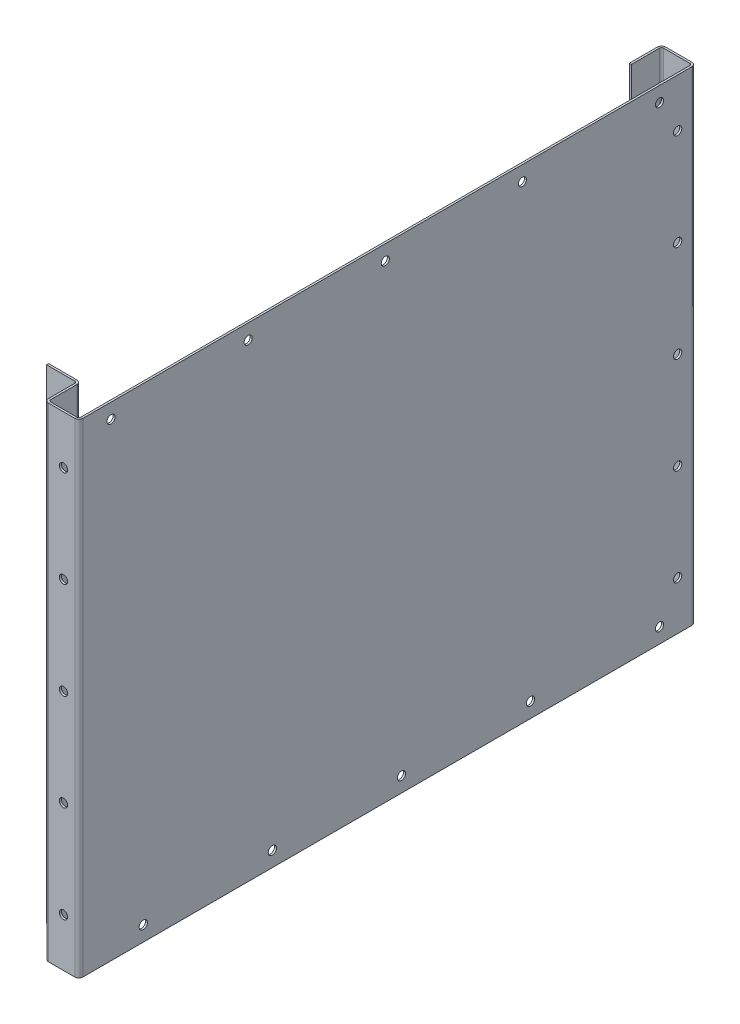
from build123d import *

# Parameters (mm, degrees)
SKETCH1_W                    = 482.6
SKETCH1_H                    = 381
BOSS_EXTRUDE1_DEPTH          = 0.9144
CONVERT_SOLID1_START         = -241.3
CONVERT_SOLID1_OUTLINE_W     = 0.6858
CONVERT_SOLID1_OUTLINE_H     = 381
CONVERT_SOLID1_DEPTH         = 482.6
EDGE_FLANGE1_STRIP_W         = 9.6012
EDGE_FLANGE1_STRIP_H         = 1.6002
EDGE_FLANGE1_STRIP_CUT_DEPTH = 381
EDGE_FLANGE1_DEPTH           = 381
EDGE_FLANGE2_STRIP_W         = 9.6012
EDGE_FLANGE2_STRIP_H         = 1.6002
EDGE_FLANGE2_STRIP_CUT_DEPTH = 381
EDGE_FLANGE2_DEPTH           = 381
EDGE_FLANGE3_STRIP_W         = 9.6012
EDGE_FLANGE3_STRIP_H         = 1.6002
EDGE_FLANGE3_STRIP_CUT_DEPTH = 381
EDGE_FLANGE3_DEPTH           = 381
EDGE_FLANGE4_STRIP_W         = 9.6012
EDGE_FLANGE4_STRIP_H         = 1.6002
EDGE_FLANGE4_STRIP_CUT_DEPTH = 381
EDGE_FLANGE4_DEPTH           = 381
EDGE_FLANGE5_STRIP_W         = 9.6012
EDGE_FLANGE5_STRIP_H         = 1.6002
EDGE_FLANGE5_STRIP_CUT_DEPTH = 381
EDGE_FLANGE5_DEPTH           = 381
SKETCH26_R                   = 3.2639
CUT_EXTRUDE2_DEPTH           = 2.54
SKETCH29_R                   = 3.2639
CUT_EXTRUDE4_DEPTH           = 310.870566463
SKETCH30_R                   = 3.2639
CUT_EXTRUDE5_DEPTH           = 2.54
SKETCH31_R                   = 3.19661248
CUT_EXTRUDE6_DEPTH           = 2.54
SKETCH32_R                   = 3.2639
CUT_EXTRUDE7_DEPTH           = 2.54


# Read off the part's stored shape, not the designer's step: Convert-Solid1
# Sheet-metal steps are written as plain solids
with BuildPart() as part:
    # Sketch1 → Boss-Extrude1 (new body)
    with BuildSketch(Plane(origin=(0, 0, 0), x_dir=(0, 0, -1), z_dir=(1, 0, 0))):
        Rectangle(SKETCH1_W, SKETCH1_H)
    extrude(amount=BOSS_EXTRUDE1_DEPTH)

    # Convert-Solid1 outline → Convert-Solid1 (add)
    with BuildSketch(Plane.XY.offset(CONVERT_SOLID1_START)):
        with Locations((-0.3429, 0)):
            Rectangle(CONVERT_SOLID1_OUTLINE_W, CONVERT_SOLID1_OUTLINE_H)
    extrude(amount=CONVERT_SOLID1_DEPTH)

    # Edge-Flange1 strip (across the edge) → Edge-Flange1 strip cut (cut)
    with BuildSketch(Plane(origin=(-0.6858, 190.5, -241.3), x_dir=(0, 0, 1), z_dir=(0, -1, 0))):
        with Locations((-3.2004, -0.8001)):
            Rectangle(EDGE_FLANGE1_STRIP_W, EDGE_FLANGE1_STRIP_H)
    extrude(amount=EDGE_FLANGE1_STRIP_CUT_DEPTH, mode=Mode.SUBTRACT)

    # Edge-Flange1 section (across the edge) → Edge-Flange1 (add)
    with BuildSketch(Plane(origin=(-0.6858, 190.5, -241.3), x_dir=(0, 0, 1), z_dir=(0, -1, 0))):
        with BuildLine():
            Line((-1.6002, 1.6002), (-1.6002, 23.7998))
            Line((-1.6002, 23.7998), (0, 23.7998))
            Line((0, 23.7998), (0, 1.6002))
            ThreePointArc((0, 1.6002), (0.468687729, 0.468687729), (1.6002, 0))
            Line((1.6002, 0), (1.6002, -1.6002))
            ThreePointArc((1.6002, -1.6002), (-0.662824543, -0.662824543), (-1.6002, 1.6002))
        make_face()
    extrude(amount=EDGE_FLANGE1_DEPTH)

    # Edge-Flange2 strip (across the edge) → Edge-Flange2 strip cut (cut)
    with BuildSketch(Plane(origin=(-24.4856, 190.5, -241.3), x_dir=(1, 0, 0), z_dir=(0, -1, 0))):
        with Locations((-3.2004, -0.8001)):
            Rectangle(EDGE_FLANGE2_STRIP_W, EDGE_FLANGE2_STRIP_H)
    extrude(amount=EDGE_FLANGE2_STRIP_CUT_DEPTH, mode=Mode.SUBTRACT)

    # Edge-Flange2 section (across the edge) → Edge-Flange2 (add)
    with BuildSketch(Plane(origin=(-24.4856, 190.5, -241.3), x_dir=(1, 0, 0), z_dir=(0, -1, 0))):
        with BuildLine():
            Line((-1.6002, 1.6002), (-1.6002, 23.7998))
            Line((-1.6002, 23.7998), (0, 23.7998))
            Line((0, 23.7998), (0, 1.6002))
            ThreePointArc((0, 1.6002), (0.468687729, 0.468687729), (1.6002, 0))
            Line((1.6002, 0), (1.6002, -1.6002))
            ThreePointArc((1.6002, -1.6002), (-0.662824543, -0.662824543), (-1.6002, 1.6002))
        make_face()
    extrude(amount=EDGE_FLANGE2_DEPTH)

    # Edge-Flange3 strip (across the edge) → Edge-Flange3 strip cut (cut)
    with BuildSketch(Plane(origin=(-0.6858, -190.5, 241.3), x_dir=(0, 0, -1), z_dir=(0, 1, 0))):
        with Locations((-3.2004, -0.8001)):
            Rectangle(EDGE_FLANGE3_STRIP_W, EDGE_FLANGE3_STRIP_H)
    extrude(amount=EDGE_FLANGE3_STRIP_CUT_DEPTH, mode=Mode.SUBTRACT)

    # Edge-Flange3 section (across the edge) → Edge-Flange3 (add)
    with BuildSketch(Plane(origin=(-0.6858, -190.5, 241.3), x_dir=(0, 0, -1), z_dir=(0, 1, 0))):
        with BuildLine():
            Line((-1.6002, 1.6002), (-1.6002, 23.7998))
            Line((-1.6002, 23.7998), (0, 23.7998))
            Line((0, 23.7998), (0, 1.6002))
            ThreePointArc((0, 1.6002), (0.468687729, 0.468687729), (1.6002, 0))
            Line((1.6002, 0), (1.6002, -1.6002))
            ThreePointArc((1.6002, -1.6002), (-0.662824543, -0.662824543), (-1.6002, 1.6002))
        make_face()
    extrude(amount=EDGE_FLANGE3_DEPTH)

    # Edge-Flange4 strip (across the edge) → Edge-Flange4 strip cut (cut)
    with BuildSketch(Plane(origin=(-24.4856, -190.5, 241.3), x_dir=(1, 0, 0), z_dir=(0, 1, 0))):
        with Locations((-3.2004, -0.8001)):
            Rectangle(EDGE_FLANGE4_STRIP_W, EDGE_FLANGE4_STRIP_H)
    extrude(amount=EDGE_FLANGE4_STRIP_CUT_DEPTH, mode=Mode.SUBTRACT)

    # Edge-Flange4 section (across the edge) → Edge-Flange4 (add)
    with BuildSketch(Plane(origin=(-24.4856, -190.5, 241.3), x_dir=(1, 0, 0), z_dir=(0, 1, 0))):
        with BuildLine():
            Line((-1.6002, 1.6002), (-1.6002, 23.7998))
            Line((-1.6002, 23.7998), (0, 23.7998))
            Line((0, 23.7998), (0, 1.6002))
            ThreePointArc((0, 1.6002), (0.468687729, 0.468687729), (1.6002, 0))
            Line((1.6002, 0), (1.6002, -1.6002))
            ThreePointArc((1.6002, -1.6002), (-0.662824543, -0.662824543), (-1.6002, 1.6002))
        make_face()
    extrude(amount=EDGE_FLANGE4_DEPTH)

    # Edge-Flange5 strip (across the edge) → Edge-Flange5 strip cut (cut)
    with BuildSketch(Plane(origin=(-26.0858, 190.5, 217.5002), x_dir=(0, 0, 1), z_dir=(0, -1, 0))):
        with Locations((-3.2004, -0.8001)):
            Rectangle(EDGE_FLANGE5_STRIP_W, EDGE_FLANGE5_STRIP_H)
    extrude(amount=EDGE_FLANGE5_STRIP_CUT_DEPTH, mode=Mode.SUBTRACT)

    # Edge-Flange5 section (across the edge) → Edge-Flange5 (add)
    with BuildSketch(Plane(origin=(-26.0858, 190.5, 217.5002), x_dir=(0, 0, 1), z_dir=(0, -1, 0))):
        with BuildLine():
            Line((-1.6002, 1.6002), (-1.6002, 23.7998))
            Line((-1.6002, 23.7998), (0, 23.7998))
            Line((0, 23.7998), (0, 1.6002))
            ThreePointArc((0, 1.6002), (0.468687729, 0.468687729), (1.6002, 0))
            Line((1.6002, 0), (1.6002, -1.6002))
            ThreePointArc((1.6002, -1.6002), (-0.662824543, -0.662824543), (-1.6002, 1.6002))
        make_face()
    extrude(amount=EDGE_FLANGE5_DEPTH)

    # Sketch26 → Cut-Extrude2 (cut)
    with BuildSketch(Plane(origin=(0, 0, 215.9), x_dir=(-1, 0, 0), z_dir=(0, 0, -1))):
        with Locations((39.41318, 152.4)):
            Circle(SKETCH26_R)
        with Locations((39.41318, 76.2)):
            Circle(SKETCH26_R)
        with Locations((39.41318, 0)):
            Circle(SKETCH26_R)
        with Locations((39.41318, -76.2)):
            Circle(SKETCH26_R)
        with Locations((39.41318, -152.4)):
            Circle(SKETCH26_R)
    extrude(amount=-CUT_EXTRUDE2_DEPTH, mode=Mode.SUBTRACT)

    # Sketch29 → Cut-Extrude4 (cut, through all)
    with BuildSketch(Plane.ZY.offset(26.0858)):
        with Locations((-228.6, 152.4)):
            Circle(SKETCH29_R)
        with Locations((-228.6, 76.2)):
            Circle(SKETCH29_R)
        with Locations((-228.6, 0)):
            Circle(SKETCH29_R)
        with Locations((-228.6, -76.2)):
            Circle(SKETCH29_R)
        with Locations((-228.6, -152.4)):
            Circle(SKETCH29_R)
    extrude(amount=-CUT_EXTRUDE4_DEPTH, mode=Mode.SUBTRACT)

    # Sketch30 → Cut-Extrude5 (cut)
    with BuildSketch(Plane.XY.offset(242.9002)):
        with Locations((-11.176, 152.4)):
            Circle(SKETCH30_R)
        with Locations((-11.176, 76.2)):
            Circle(SKETCH30_R)
        with Locations((-11.176, 0)):
            Circle(SKETCH30_R)
        with Locations((-11.176, -76.2)):
            Circle(SKETCH30_R)
        with Locations((-11.176, -152.4)):
            Circle(SKETCH30_R)
    extrude(amount=-CUT_EXTRUDE5_DEPTH, mode=Mode.SUBTRACT)

    # Sketch31 → Cut-Extrude6 (cut)
    with BuildSketch(Plane(origin=(0.9144, 0, 0), x_dir=(0, 0, -1), z_dir=(1, 0, 0))):
        with Locations((-217.5002, 178.689)):
            Circle(SKETCH31_R)
        with Locations((-109.5502, 178.689)):
            Circle(SKETCH31_R)
        with Locations((-1.6002, 178.689)):
            Circle(SKETCH31_R)
        with Locations((106.3498, 178.689)):
            Circle(SKETCH31_R)
        with Locations((214.2998, 178.689)):
            Circle(SKETCH31_R)
    extrude(amount=-CUT_EXTRUDE6_DEPTH, mode=Mode.SUBTRACT)

    # Sketch32 → Cut-Extrude7 (cut)
    with BuildSketch(Plane.ZY.offset(0.6858)):
        with Locations((-214.2998, -178.7144)):
            Circle(SKETCH32_R)
        with Locations((-112.6998, -178.7144)):
            Circle(SKETCH32_R)
        with Locations((-11.0998, -178.7144)):
            Circle(SKETCH32_R)
        with Locations((90.5002, -178.7144)):
            Circle(SKETCH32_R)
        with Locations((192.1002, -178.7144)):
            Circle(SKETCH32_R)
    extrude(amount=-CUT_EXTRUDE7_DEPTH, mode=Mode.SUBTRACT)


solid = part.part
